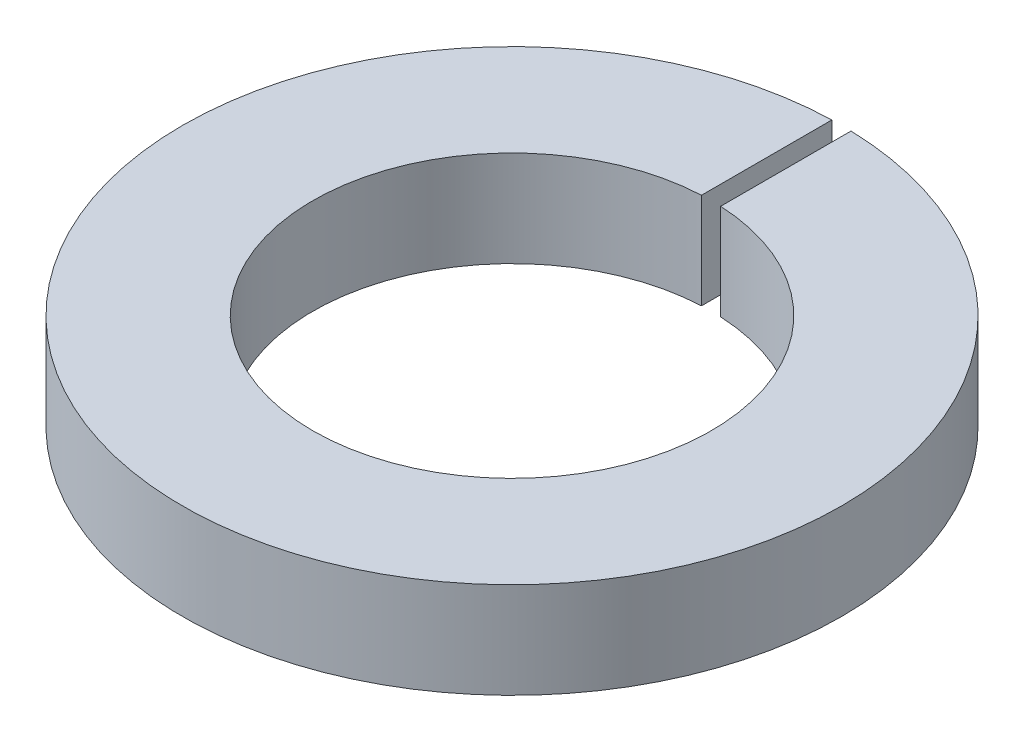
from build123d import *

# Parameters (mm, degrees)
SKETCH1_R               = 4.3
SKETCH1_R_2             = 2.6
BOSS_EXTRUDE1_DEPTH     = 1.25
SKETCH2_W               = 0.25
SKETCH2_H               = 4.3
CUT_EXTRUDE1_DEPTH      = 7.208260626
BODY_MOVE_COPY1_DEPTH   = 1.25
BODY_MOVE_COPY1_2_DEPTH = 1.25


# Read off the part's stored shape, not the designer's step: Body-Move/Copy1
with BuildPart() as part:
    # Sketch1 → Boss-Extrude1 (new body)
    with BuildSketch(Plane(origin=(0, 0, 0), x_dir=(1, 0, 0), z_dir=(0, 1, 0))):
        with Locations(Location((0, 0, 0), (0, 0, 270))):
            Circle(SKETCH1_R)
        with Locations(Location((0, 0, 0), (0, 0, 270))):
            Circle(SKETCH1_R_2, mode=Mode.SUBTRACT)
    extrude(amount=BOSS_EXTRUDE1_DEPTH)

    # Sketch2 → Cut-Extrude1 (cut, through all)
    with BuildSketch(Plane.XZ):
        with Locations((0, 2.15)):
            Rectangle(SKETCH2_W, SKETCH2_H)
    extrude(amount=-CUT_EXTRUDE1_DEPTH, mode=Mode.SUBTRACT)

    # Body-Move/Copy1 outline → Body-Move/Copy1 (cut)
    with BuildSketch(Plane(origin=(0, 0, 0), x_dir=(1, 0, 0), z_dir=(0, 1, 0))):
        with BuildLine():
            Line((0.125, 2.596993454), (0.125, 4.298182756))
            ThreePointArc((0.125, 4.298182756), (0, 4.3), (-0.125, 4.298182756))
            Line((-0.125, 4.298182756), (-0.125, 2.596993454))
            ThreePointArc((-0.125, 2.596993454), (0, 2.6), (0.125, 2.596993454))
        make_face()
    extrude(amount=BODY_MOVE_COPY1_DEPTH, mode=Mode.SUBTRACT)

    # Body-Move_Copy1 2 outline → Body-Move_Copy1 2 (add)
    with BuildSketch(Plane(origin=(0, 0, 0), x_dir=(1, 0, 0), z_dir=(0, 1, 0))):
        with BuildLine():
            ThreePointArc((-0.125, -4.298182756), (0, -4.3), (0.125, -4.298182756))
            Line((0.125, -4.298182756), (0.125, -2.596993454))
            ThreePointArc((0.125, -2.596993454), (0, -2.6), (-0.125, -2.596993454))
            Line((-0.125, -2.596993454), (-0.125, -4.298182756))
        make_face()
    extrude(amount=BODY_MOVE_COPY1_2_DEPTH)


solid = part.part
